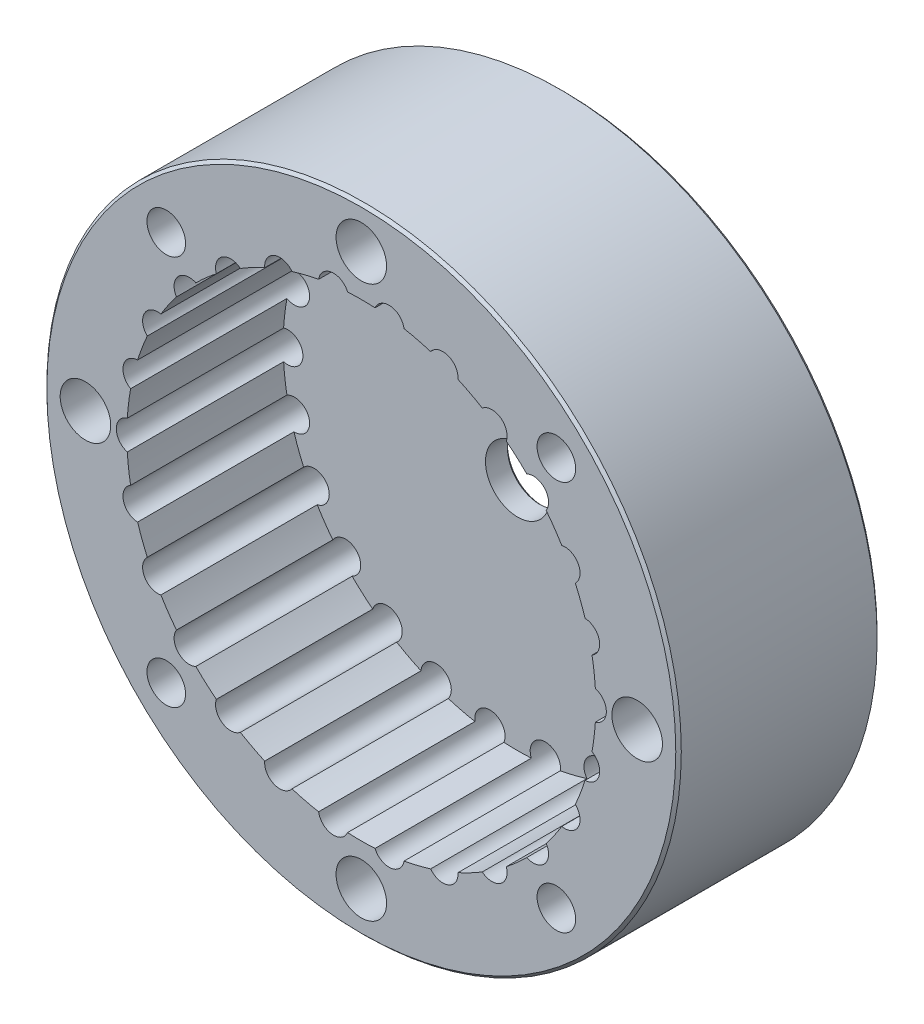
from build123d import *

# Parameters (mm, degrees)
SKETCH1_R               = 34.5
SKETCH1_R_2             = 25.5
BOSS_EXTRUDE2_DEPTH     = 17
BOSS_EXTRUDE3_START     = -5
SKETCH1_3_R             = 34.5
BOSS_EXTRUDE3_DEPTH     = 5
CUT_EXTRUDE4_DEPTH      = 52.667204298
CUT_EXTRUDE4_DEPTH_BACK = 3
SKETCH1_5_R             = 1.65
CUT_EXTRUDE6_DEPTH      = 52.667204298
CUT_EXTRUDE6_DEPTH_BACK = 52.667204298
SKETCH3_R               = 1.8
SKETCH3_R_2             = 3.5
SKETCH4_R               = 10.15
CUT_EXTRUDE7_DEPTH      = 2.3
SKETCH6_R               = 2.1
CUT_EXTRUDE8_DEPTH      = 10
SKETCH7_R               = 2.75
CUT_EXTRUDE9_DEPTH      = 10
CHAMFER1_SIZE           = 0.4
CHAMFER2_SIZE           = 0.3
CHAMFER3_SIZE           = 0.4
CHAMFER4_SIZE           = 0.3


with BuildPart() as part:
    # Sketch1 → Boss-Extrude2 (new body)
    with BuildSketch(Plane.XY):
        Circle(SKETCH1_R)
        Circle(SKETCH1_R_2, mode=Mode.SUBTRACT)
    extrude(amount=BOSS_EXTRUDE2_DEPTH)

    # Sketch1<3> → Boss-Extrude3 (add)
    with BuildSketch(Plane.XY.offset(BOSS_EXTRUDE3_START)):
        Circle(SKETCH1_3_R)
    extrude(amount=BOSS_EXTRUDE3_DEPTH)

    # Sketch1<5> → Cut-Extrude4 (cut, two sides: drawn at the far end of the back side and taken through both)
    with BuildSketch(Plane.XY.offset(-CUT_EXTRUDE4_DEPTH_BACK)):
        with Locations((25, 0)):
            Circle(SKETCH1_5_R)
        with Locations((24.273545436, -5.982891607)):
            Circle(SKETCH1_5_R)
        with Locations((22.136400641, -11.618079301)):
            Circle(SKETCH1_5_R)
        with Locations((18.712768704, -16.578066456)):
            Circle(SKETCH1_5_R)
        with Locations((14.201618668, -20.574596647)):
            Circle(SKETCH1_5_R)
        with Locations((8.865122176, -23.375406067)):
            Circle(SKETCH1_5_R)
        with Locations((3.013417006, -24.817721852)):
            Circle(SKETCH1_5_R)
        with Locations((-3.013417006, -24.817721852)):
            Circle(SKETCH1_5_R)
        with Locations((-8.865122176, -23.375406067)):
            Circle(SKETCH1_5_R)
        with Locations((-14.201618668, -20.574596647)):
            Circle(SKETCH1_5_R)
        with Locations((-18.712768704, -16.578066456)):
            Circle(SKETCH1_5_R)
        with Locations((-22.136400641, -11.618079301)):
            Circle(SKETCH1_5_R)
        with Locations((-24.273545436, -5.982891607)):
            Circle(SKETCH1_5_R)
        with Locations((-25, 0)):
            Circle(SKETCH1_5_R)
        with Locations((-24.273545436, 5.982891607)):
            Circle(SKETCH1_5_R)
        with Locations((-22.136400641, 11.618079301)):
            Circle(SKETCH1_5_R)
        with Locations((-18.712768704, 16.578066456)):
            Circle(SKETCH1_5_R)
        with Locations((-14.201618668, 20.574596647)):
            Circle(SKETCH1_5_R)
        with Locations((-8.865122176, 23.375406067)):
            Circle(SKETCH1_5_R)
        with Locations((-3.013417006, 24.817721852)):
            Circle(SKETCH1_5_R)
        with Locations((3.013417006, 24.817721852)):
            Circle(SKETCH1_5_R)
        with Locations((8.865122176, 23.375406067)):
            Circle(SKETCH1_5_R)
        with Locations((14.201618668, 20.574596647)):
            Circle(SKETCH1_5_R)
        with Locations((18.712768704, 16.578066456)):
            Circle(SKETCH1_5_R)
        with Locations((22.136400641, 11.618079301)):
            Circle(SKETCH1_5_R)
        with Locations((24.273545436, 5.982891607)):
            Circle(SKETCH1_5_R)
    extrude(amount=CUT_EXTRUDE4_DEPTH + CUT_EXTRUDE4_DEPTH_BACK, mode=Mode.SUBTRACT)

    # Sketch3 → Cut-Extrude6 (cut, two sides: drawn at the far end of the back side and taken through both)
    with BuildSketch(Plane.XY.offset(-CUT_EXTRUDE6_DEPTH_BACK)):
        with Locations((0, 30)):
            Circle(SKETCH3_R)
        with Locations((30, 0)):
            Circle(SKETCH3_R)
        with Locations((0, -30)):
            Circle(SKETCH3_R)
        with Locations((-30, 0)):
            Circle(SKETCH3_R)
        Circle(SKETCH3_R_2)
    extrude(amount=CUT_EXTRUDE6_DEPTH + CUT_EXTRUDE6_DEPTH_BACK, mode=Mode.SUBTRACT)

    # Sketch4 → Cut-Extrude7 (cut)
    with BuildSketch(Plane(origin=(0, 0, -5), x_dir=(-1, 0, 0), z_dir=(0, 0, -1))):
        Circle(SKETCH4_R)
    extrude(amount=-CUT_EXTRUDE7_DEPTH, mode=Mode.SUBTRACT)

    # Sketch6 → Cut-Extrude8 (cut)
    with BuildSketch(Plane.XY.offset(17)):
        with Locations((-21.213203436, 21.213203436)):
            Circle(SKETCH6_R)
        with Locations((21.213203436, 21.213203436)):
            Circle(SKETCH6_R)
        with Locations((21.213203436, -21.213203436)):
            Circle(SKETCH6_R)
        with Locations((-21.213203436, -21.213203436)):
            Circle(SKETCH6_R)
    extrude(amount=-CUT_EXTRUDE8_DEPTH, mode=Mode.SUBTRACT)

    # Sketch7 → Cut-Extrude9 (cut)
    with BuildSketch(Plane.XY.offset(17)):
        with Locations((0, 30)):
            Circle(SKETCH7_R)
        with Locations((30, 0)):
            Circle(SKETCH7_R)
        with Locations((0, -30)):
            Circle(SKETCH7_R)
        with Locations((-30, 0)):
            Circle(SKETCH7_R)
    extrude(amount=-CUT_EXTRUDE9_DEPTH, mode=Mode.SUBTRACT)

    # Chamfer1
    chamfer1_edges = [part.edges().sort_by_distance(p)[0] for p in [
        (10.15, 0, -5),
        (-1.8, -30, -5),
        (-31.8, 0, -5),
        (28.2, 0, -5),
        (-1.8, 30, -5),
    ]]
    chamfer(chamfer1_edges, length=CHAMFER1_SIZE)

    # Chamfer2
    chamfer2_edges = [part.edges().sort_by_distance(p)[0] for p in [
        (-3.5, 0, -2.7),
    ]]
    chamfer(chamfer2_edges, length=CHAMFER2_SIZE)

    # Chamfer3
    chamfer3_edges = [part.edges().sort_by_distance(p)[0] for p in [
        (-34.5, 0, -5),
    ]]
    chamfer(chamfer3_edges, length=CHAMFER3_SIZE)

    # Chamfer4
    chamfer4_edges = [part.edges().sort_by_distance(p)[0] for p in [
        (-34.5, 0, 17),
    ]]
    chamfer(chamfer4_edges, length=CHAMFER4_SIZE)


solid = part.part
